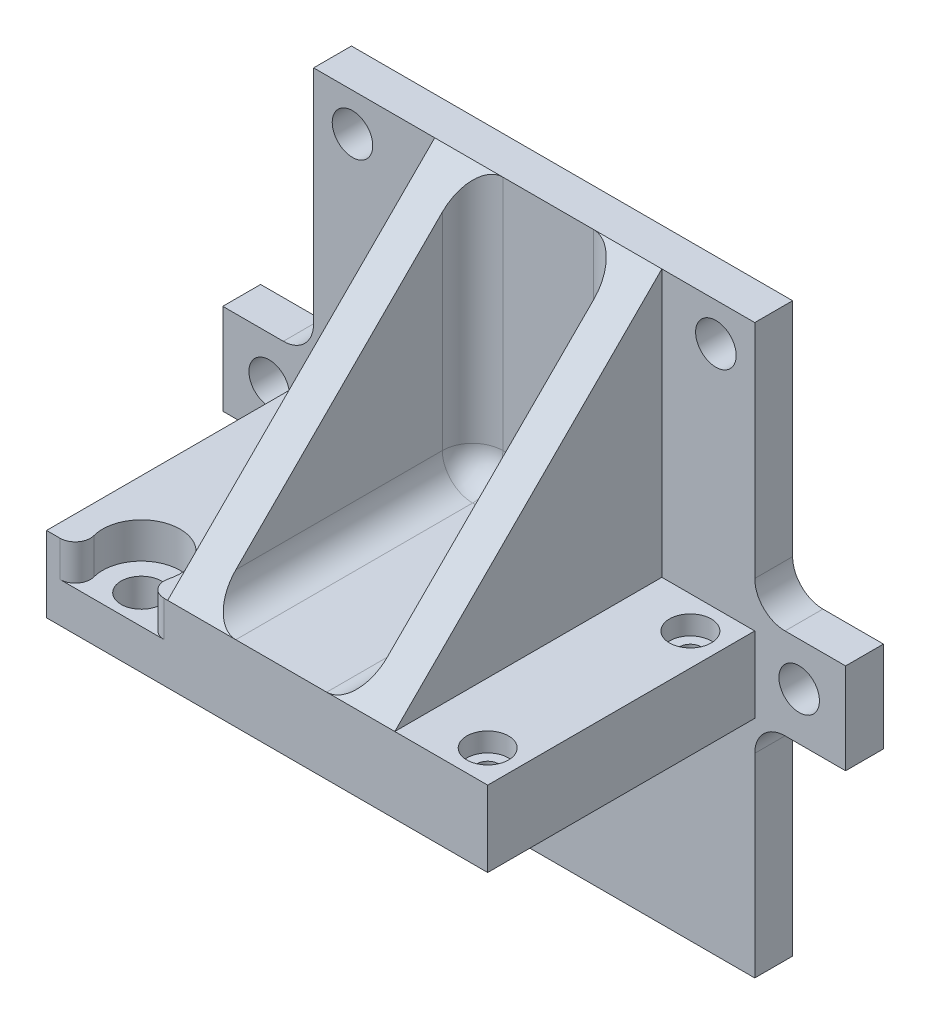
from build123d import *

# Parameters (mm, degrees)
SKETCH1_W                        = 37
SKETCH1_H                        = 22.4
BOSS_EXTRUDE1_DEPTH              = 6.35
SKETCH7_W                        = 3.175
SKETCH7_H                        = 47.610000126
BOSS_EXTRUDE2_DEPTH              = 37
CBORE_FOR_M3_SHCS3_AT_2_COUNT    = 2
CBORE_FOR_M3_SHCS3_AT_2_PITCH    = 17.5
CBORE_FOR_M1_6_SHCS1_D           = 1.8
CBORE_FOR_M1_6_SHCS1_CBORE_D     = 3.5
CBORE_FOR_M1_6_SHCS1_CBORE_DEPTH = 1.6
BOSS_EXTRUDE3_START              = -10.16
BOSS_EXTRUDE3_DEPTH              = 3.175
BOSS_EXTRUDE4_START              = -29.21
BOSS_EXTRUDE4_DEPTH              = 3.175
SKETCH18_W                       = 7.62
SKETCH18_H                       = 7.62
BOSS_EXTRUDE5_DEPTH              = 3.175
M3_CLEARANCE_HOLE1_D             = 3.4
FILLET1_R                        = 2.54
FILLET2_R                        = 1.27


with BuildPart() as part:
    # Sketch1 → Boss-Extrude1 (new body)
    with BuildSketch(Plane(origin=(0, 0, 0), x_dir=(1, 0, 0), z_dir=(0, 1, 0))):
        with Locations((18.5, 11.2)):
            Rectangle(SKETCH1_W, SKETCH1_H)
    extrude(amount=BOSS_EXTRUDE1_DEPTH)

    # Sketch7 → Boss-Extrude2 (add)
    with BuildSketch(Plane(origin=(37, 0, 0), x_dir=(0, 0, -1), z_dir=(1, 0, 0))):
        with Locations((-1.5875, 4.944999937)):
            Rectangle(SKETCH7_W, SKETCH7_H)
    extrude(amount=-BOSS_EXTRUDE2_DEPTH)

    # Sketch13 → CBORE for M3 SHCS3 (revolve, cut)
    with BuildSketch(Plane(origin=(5.5, 13.97, -2.45), x_dir=(0, 0, 1), z_dir=(1, 0, 0))):
        Polygon((0, 0), (0, 32.830000126), (1.7, 32.830000126), (1.7, 10.62), (3.25, 10.62), (3.25, 0), align=None)
    cbore_for_m3_shcs3 = revolve(axis=Axis((5.5, 20.32, -2.45), (0, -1, 0)), mode=Mode.SUBTRACT)

    # CBORE for M3 SHCS3 at 2: CBORE for M3 SHCS3 ×2
    with Locations(*[(0, 0, -i * CBORE_FOR_M3_SHCS3_AT_2_PITCH) for i in range(1, CBORE_FOR_M3_SHCS3_AT_2_COUNT)]):
        add(cbore_for_m3_shcs3, mode=Mode.SUBTRACT)

    # CBORE for M1.6 SHCS1 (through all)
    with Locations(Plane(origin=(0, 6.35, 0), x_dir=(1, 0, 0), z_dir=(0, 1, 0))):
        with Locations((34.3, 19.7), (34.3, 2.7)):
            CounterBoreHole(CBORE_FOR_M1_6_SHCS1_D / 2, CBORE_FOR_M1_6_SHCS1_CBORE_D / 2, CBORE_FOR_M1_6_SHCS1_CBORE_DEPTH)

    # Sketch16 → Boss-Extrude3 (add)
    with BuildSketch(Plane.ZY.offset(BOSS_EXTRUDE3_START)):
        Polygon((-22.4, 6.35), (0, 6.35), (0, 28.75), align=None)
    extrude(amount=-BOSS_EXTRUDE3_DEPTH)

    # Sketch16<2> → Boss-Extrude4 (add)
    with BuildSketch(Plane.ZY.offset(BOSS_EXTRUDE4_START)):
        Polygon((-22.4, 6.35), (0, 6.35), (0, 28.75), align=None)
    extrude(amount=BOSS_EXTRUDE4_DEPTH)

    # Sketch18 → Boss-Extrude5 (add, through all)
    with BuildSketch(Plane.XY):
        with Locations((40.81, 3.81)):
            Rectangle(SKETCH18_W, SKETCH18_H)
        with Locations((-3.81, 3.81)):
            Rectangle(SKETCH18_W, SKETCH18_H)
    extrude(amount=BOSS_EXTRUDE5_DEPTH)

    # M3 Clearance Hole1 (through all)
    with Locations(Plane(origin=(0, 0, 0), x_dir=(-1, 0, 0), z_dir=(0, 0, -1))):
        with Locations((-40.725, 3.985), (-33.74, 25.575), (-3.26, 25.575), (3.725, 3.985)):
            Hole(M3_CLEARANCE_HOLE1_D / 2)

    # Fillet1
    # the kernel refuses this fillet: 2.54 mm, written as the material it adds along each edge
    with BuildSketch(Plane(origin=(15.875, 8.89, -2.54), x_dir=(0, -1, 0), z_dir=(-1, 0, 0))) as fillet1_piece_1_section:
        Polygon((0, 0), (FILLET1_R, 0), (FILLET1_R, FILLET1_R), (0, FILLET1_R), align=None)
    fillet1_piece_1 = extrude(amount=FILLET1_R, mode=Mode.PRIVATE)
    fillet1_piece_1 = fillet1_piece_1 - Plane(origin=(15.875, 8.89, -2.54), x_dir=(0, 0.7071067811865475, -0.7071067811865475), z_dir=(-1, 0, 0)) * Sphere(FILLET1_R, mode=Mode.PRIVATE)
    add(fillet1_piece_1)
    with BuildSketch(Plane(origin=(23.495, 8.89, -2.54), x_dir=(1, 0, 0), z_dir=(0, -1, 0))) as fillet1_piece_2_section:
        Polygon((0, 0), (FILLET1_R, 0), (FILLET1_R, FILLET1_R), (0, FILLET1_R), align=None)
    fillet1_piece_2 = extrude(amount=FILLET1_R, mode=Mode.PRIVATE)
    fillet1_piece_2 = fillet1_piece_2 - Plane(origin=(23.495, 8.89, -2.54), x_dir=(-0.7071067811865475, 0, -0.7071067811865475), z_dir=(0, -1, 0)) * Sphere(FILLET1_R, mode=Mode.PRIVATE)
    add(fillet1_piece_2)
    with BuildSketch(Plane(origin=(0, 0, 0), x_dir=(0, -1, 0), z_dir=(0, 0, 1)), Plane(origin=(37, 7.62, 0), x_dir=(0, 1, 0), z_dir=(0, 0, 1))) as fillet1_piece_3:
        with BuildLine():
            CenterArc((FILLET1_R, -FILLET1_R), FILLET1_R, 90, 90)
            Line((0, -FILLET1_R), (0, 0))
            Line((0, 0), (FILLET1_R, 0))
        make_face()
    extrude(amount=3.175)
    with BuildSketch(Plane(origin=(0, 7.62, 0), x_dir=(0, 1, 0), z_dir=(0, 0, 1)), Plane(origin=(37, 0, 0), x_dir=(0, -1, 0), z_dir=(0, 0, 1))) as fillet1_piece_4:
        with BuildLine():
            CenterArc((FILLET1_R, FILLET1_R), FILLET1_R, 180, 90)
            Line((0, FILLET1_R), (0, 0))
            Line((0, 0), (FILLET1_R, 0))
        make_face()
    extrude(amount=3.175)
    with BuildSketch(Plane(origin=(15.875, 6.35, 0), x_dir=(0, 0, -1), z_dir=(1, 0, 0))) as fillet1_piece_5:
        with BuildLine():
            CenterArc((FILLET1_R, FILLET1_R), FILLET1_R, 180, 90)
            Line((0, FILLET1_R), (0, 0))
            Line((0, 0), (FILLET1_R, 0))
        make_face()
    extrude(amount=7.62)
    with BuildSketch(Plane(origin=(13.335, 8.89, 0), x_dir=(1, 0, 0), z_dir=(0, 1, 0))) as fillet1_piece_6_section:
        with BuildLine():
            CenterArc((FILLET1_R, FILLET1_R), FILLET1_R, 180, 90)
            Line((0, FILLET1_R), (0, 0))
            Line((0, 0), (FILLET1_R, 0))
        make_face()
    fillet1_piece_6 = extrude(amount=19.86, mode=Mode.PRIVATE)
    fillet1_piece_6 = split(fillet1_piece_6, bisect_by=Plane(origin=(13.919159385, 23.364808453, -5.385191547), z_dir=(0, -0.7071067811865476, 0.7071067811865476)), keep=Keep.TOP, mode=Mode.PRIVATE)
    add(fillet1_piece_6)
    with BuildSketch(Plane(origin=(13.335, 6.35, -22.4), x_dir=(1, 0, 0), z_dir=(0, 0, 1))) as fillet1_piece_7_section:
        with BuildLine():
            CenterArc((FILLET1_R, FILLET1_R), FILLET1_R, 180, 90)
            Line((0, FILLET1_R), (0, 0))
            Line((0, 0), (FILLET1_R, 0))
        make_face()
    fillet1_piece_7 = extrude(amount=19.86, mode=Mode.PRIVATE)
    fillet1_piece_7 = split(fillet1_piece_7, bisect_by=Plane(origin=(13.919159385, 11.735191547, -17.014808453), z_dir=(0, -0.7071067811865476, 0.7071067811865476)), keep=Keep.TOP, mode=Mode.PRIVATE)
    add(fillet1_piece_7)
    with BuildSketch(Plane(origin=(26.035, 6.35, -22.4), x_dir=(-1, 0, 0), z_dir=(0, 0, 1))) as fillet1_piece_8_section:
        with BuildLine():
            CenterArc((FILLET1_R, -FILLET1_R), FILLET1_R, 90, 90)
            Line((0, -FILLET1_R), (0, 0))
            Line((0, 0), (FILLET1_R, 0))
        make_face()
    fillet1_piece_8 = extrude(amount=19.86, mode=Mode.PRIVATE)
    fillet1_piece_8 = split(fillet1_piece_8, bisect_by=Plane(origin=(25.450840615, 11.735191547, -17.014808453), z_dir=(0, -0.7071067811865476, 0.7071067811865476)), keep=Keep.TOP, mode=Mode.PRIVATE)
    add(fillet1_piece_8)
    with BuildSketch(Plane(origin=(26.035, 8.89, 0), x_dir=(-1, 0, 0), z_dir=(0, 1, 0))) as fillet1_piece_9_section:
        with BuildLine():
            CenterArc((FILLET1_R, -FILLET1_R), FILLET1_R, 90, 90)
            Line((0, -FILLET1_R), (0, 0))
            Line((0, 0), (FILLET1_R, 0))
        make_face()
    fillet1_piece_9 = extrude(amount=19.86, mode=Mode.PRIVATE)
    fillet1_piece_9 = split(fillet1_piece_9, bisect_by=Plane(origin=(25.450840615, 23.364808453, -5.385191547), z_dir=(0, -0.7071067811865476, 0.7071067811865476)), keep=Keep.TOP, mode=Mode.PRIVATE)
    add(fillet1_piece_9)

    # Fillet2
    fillet2_edges = [part.edges().sort_by_distance(p)[0] for p in [
        (7.63541565, 4.85, -22.4),
        (3.36458435, 4.85, -22.4),
    ]]
    fillet(fillet2_edges, radius=FILLET2_R)


with BuildPart() as body_2:
    # Mirror1: mirrored copy
    add(part.part.mirror(Plane.XY))


solid = body_2.part
